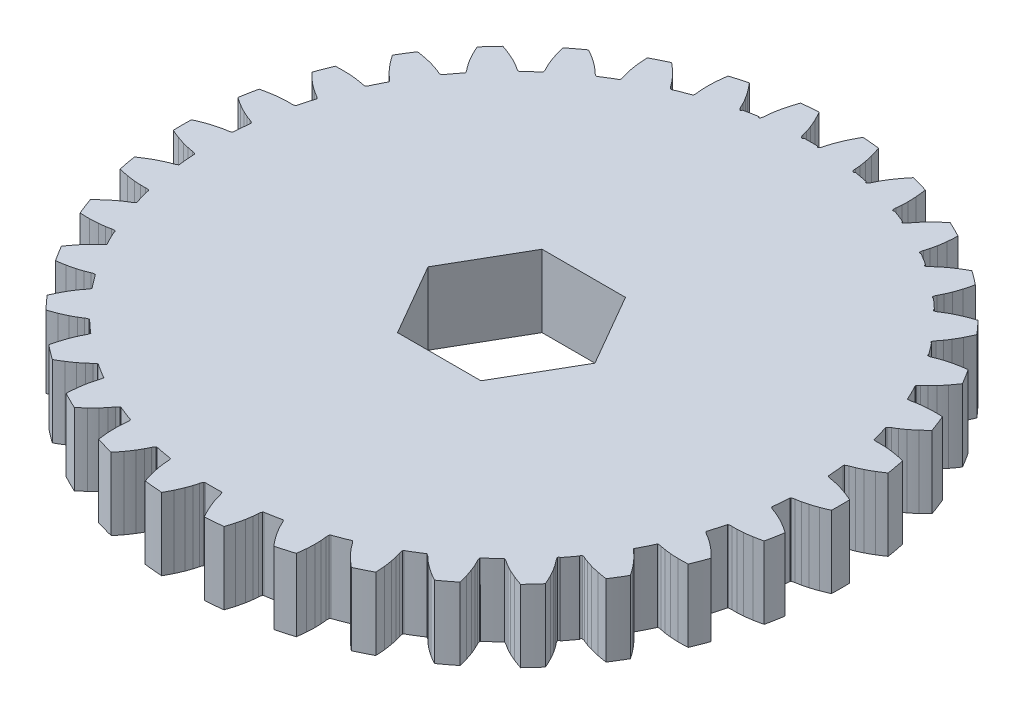
from build123d import *

# Parameters (mm, degrees)
BOSS_EXTRUDE1_DEPTH = 6.35


with BuildPart() as part:
    # Model → Boss-Extrude1 (new body)
    with BuildSketch(Plane(origin=(0, 0, 0), x_dir=(1, 0, 0), z_dir=(0, 1, 0))):
        with BuildLine():
            ThreePointArc((26.039547017, -3.158714239), (26.081656494, -2.789745335), (26.118538109, -2.420217249))
            ThreePointArc((26.118538109, -2.420217249), (26.15018278, -2.050225616), (26.176586464, -1.67982308))
            ThreePointArc((26.176586464, -1.67982308), (26.19430218, -1.656128647), (26.21828275, -1.638802221))
            ThreePointArc((26.21828275, -1.638802221), (26.349972724, -1.58470137), (26.488875474, -1.553473543))
            ThreePointArc((26.488875474, -1.553473543), (26.716015585, -1.517661861), (26.941580978, -1.472992407))
            ThreePointArc((26.941580978, -1.472992407), (27.208998909, -1.40997215), (27.474210372, -1.338231068))
            ThreePointArc((27.474210372, -1.338231068), (27.822373625, -1.230698091), (28.166198085, -1.110009516))
            ThreePointArc((28.166198085, -1.110009516), (28.547173014, -0.960699832), (28.922876054, -0.798581036))
            ThreePointArc((28.922876054, -0.798581036), (28.933898647, 0), (28.922876054, 0.798581036))
            ThreePointArc((28.922876054, 0.798581036), (28.547173011, 0.960699833), (28.166198079, 1.110009518))
            ThreePointArc((28.166198079, 1.110009518), (27.822373616, 1.230698094), (27.47421036, 1.338231071))
            ThreePointArc((27.47421036, 1.338231071), (27.208998897, 1.409972153), (26.941580965, 1.47299241))
            ThreePointArc((26.941580965, 1.47299241), (26.716015572, 1.517661864), (26.488875461, 1.553473545))
            ThreePointArc((26.488875461, 1.553473545), (26.349972724, 1.584701369), (26.218282762, 1.638802211))
            ThreePointArc((26.218282762, 1.638802211), (26.188796618, 1.65750247), (26.16748445, 1.685159727))
            ThreePointArc((26.16748445, 1.685159727), (26.111416775, 2.402273868), (26.035700465, 3.117580318))
            ThreePointArc((26.035700465, 3.117580318), (26.04260123, 3.167055317), (26.072995781, 3.206698314))
            ThreePointArc((26.072995781, 3.206698314), (26.192502478, 3.284075965), (26.323302047, 3.340295392))
            ThreePointArc((26.323302047, 3.340295392), (26.539994286, 3.417234198), (26.753511009, 3.502590602))
            ThreePointArc((26.753511009, 3.502590602), (27.0047957, 3.613675735), (27.252309044, 3.732927767))
            ThreePointArc((27.252309044, 3.732927767), (27.574785023, 3.902604621), (27.890578752, 4.084415822))
            ThreePointArc((27.890578752, 4.084415822), (28.237631276, 4.301187185), (28.577148007, 4.529580852))
            ThreePointArc((28.577148007, 4.529580852), (28.441244039, 5.316589925), (28.283670246, 6.099548205))
            ThreePointArc((28.283670246, 6.099548205), (27.884575011, 6.189871369), (27.482651318, 6.266634813))
            ThreePointArc((27.482651318, 6.266634813), (27.122504653, 6.322090857), (26.760510405, 6.36381805))
            ThreePointArc((26.760510405, 6.36381805), (26.486632282, 6.385605126), (26.212187706, 6.398414427))
            ThreePointArc((26.212187706, 6.398414427), (25.982255002, 6.400875766), (25.752402004, 6.394340799))
            ThreePointArc((25.752402004, 6.394340799), (25.610126253, 6.399513599), (25.470737559, 6.428495305))
            ThreePointArc((25.470737559, 6.428495305), (25.442493252, 6.434082805), (25.416780324, 6.447036816))
            ThreePointArc((25.416780324, 6.447036816), (25.227894102, 7.150549974), (25.019539308, 7.848544995))
            ThreePointArc((25.019539308, 7.848544995), (25.017231567, 7.8984456), (25.039824212, 7.942998585))
            ThreePointArc((25.039824212, 7.942998585), (25.143077974, 8.041018031), (25.261320139, 8.120314574))
            ThreePointArc((25.261320139, 8.120314574), (25.460185313, 8.235760445), (25.65438231, 8.358897088))
            ThreePointArc((25.65438231, 8.358897088), (25.880976562, 8.514264227), (26.102363017, 8.676966225))
            ThreePointArc((26.102363017, 8.676966225), (26.38817019, 8.903008813), (26.665179209, 9.139751279))
            ThreePointArc((26.665179209, 9.139751279), (26.966490872, 9.41660243), (27.258259459, 9.703493297))
            ThreePointArc((27.258259459, 9.703493297), (26.980056976, 10.452129756), (26.681297971, 11.192802576))
            ThreePointArc((26.681297971, 11.192802576), (26.272401252, 11.208254259), (25.863215829, 11.209857374))
            ThreePointArc((25.863215829, 11.209857374), (25.499011323, 11.198192398), (25.135513364, 11.172692838))
            ThreePointArc((25.135513364, 11.172692838), (24.862295171, 11.143783974), (24.590169834, 11.105946114))
            ThreePointArc((24.590169834, 11.105946114), (24.363699901, 11.06611552), (24.138961384, 11.017456446))
            ThreePointArc((24.138961384, 11.017456446), (23.998157648, 10.996398069), (23.855816937, 10.999273701))
            ThreePointArc((23.855816937, 10.999273701), (23.829640328, 10.995976243), (23.803412998, 10.998842458))
            ThreePointArc((23.803412998, 10.998842458), (23.486572972, 11.660098447), (23.151367748, 12.312236886))
            ThreePointArc((23.151367748, 12.312236886), (23.139930089, 12.360863792), (23.153951461, 12.408809565))
            ThreePointArc((23.153951461, 12.408809565), (23.237436106, 12.524132873), (23.339094271, 12.623806182))
            ThreePointArc((23.339094271, 12.623806182), (23.513360265, 12.773827747), (23.68162439, 12.93055136))
            ThreePointArc((23.68162439, 12.93055136), (23.875811807, 13.124909663), (24.063532324, 13.325521004))
            ThreePointArc((24.063532324, 13.325521004), (24.30293787, 13.600231718), (24.531728971, 13.883843467))
            ThreePointArc((24.531728971, 13.883843467), (24.793149492, 14.23368498), (25.041761869, 14.592741603))
            ThreePointArc((25.041761869, 14.592741603), (24.642190217, 15.257798213), (24.224960364, 15.911921328))
            ThreePointArc((24.224960364, 15.911921328), (23.79272998, 15.849417962), (23.363039544, 15.771341688))
            ThreePointArc((23.363039544, 15.771341688), (23.007179746, 15.692952927), (22.654556562, 15.601094971))
            ThreePointArc((22.654556562, 15.601094971), (22.391302418, 15.522474625), (22.13076322, 15.435278127))
            ThreePointArc((22.13076322, 15.435278127), (21.91546822, 15.354511984), (21.703497385, 15.265385829))
            ThreePointArc((21.703497385, 15.265385829), (21.568960567, 15.218813392), (21.428515081, 15.195485023))
            ThreePointArc((21.428515081, 15.195485023), (21.339460922, 15.238312212), (21.332995773, 15.336917553))
            ThreePointArc((21.332995773, 15.336917553), (20.967023721, 15.833561348), (20.58949199, 16.321475677))
            ThreePointArc((20.58949199, 16.321475677), (20.496420127, 16.354678643), (20.479598664, 16.452053418))
            ThreePointArc((20.479598664, 16.452053418), (20.540471221, 16.580753391), (20.622083541, 16.697409211))
            ThreePointArc((20.622083541, 16.697409211), (20.765815935, 16.876897667), (20.902417155, 17.061871214))
            ThreePointArc((20.902417155, 17.061871214), (21.057584918, 17.288602041), (21.205246899, 17.520291148))
            ThreePointArc((21.205246899, 17.520291148), (21.390098149, 17.834315043), (21.562880125, 18.155138018))
            ThreePointArc((21.562880125, 18.155138018), (21.758877489, 18.554118686), (21.940072505, 18.960036049))
            ThreePointArc((21.940072505, 18.960036049), (21.42934408, 19.535428351), (20.903530375, 20.097068602))
            ThreePointArc((20.903530375, 20.097068602), (20.482626013, 19.95409986), (20.067262968, 19.795751876))
            ThreePointArc((20.067262968, 19.795751876), (19.731866256, 19.653308767), (19.402126007, 19.498220527))
            ThreePointArc((19.402126007, 19.498220527), (19.157800716, 19.372566019), (18.917720007, 19.238980255))
            ThreePointArc((18.917720007, 19.238980255), (18.720931554, 19.120028957), (18.528946813, 18.993470805))
            ThreePointArc((18.528946813, 18.993470805), (18.405258403, 18.922970277), (18.271490845, 18.874232328))
            ThreePointArc((18.271490845, 18.874232328), (18.171589021, 18.904840123), (18.156103069, 19.008171613))
            ThreePointArc((18.156103069, 19.008171613), (17.70877484, 19.425600644), (17.251852246, 19.832505158))
            ThreePointArc((17.251852246, 19.832505158), (17.147532701, 19.838390811), (17.107837696, 19.935042324))
            ThreePointArc((17.107837696, 19.935042324), (17.144025225, 20.072736238), (17.202812489, 20.202401996))
            ThreePointArc((17.202812489, 20.202401996), (17.311116648, 20.405245077), (17.411403173, 20.612169507))
            ThreePointArc((17.411403173, 20.612169507), (17.52226723, 20.863551813), (17.624842223, 21.11842879))
            ThreePointArc((17.624842223, 21.11842879), (17.748844291, 21.46107216), (17.859733257, 21.808181118))
            ThreePointArc((17.859733257, 21.808181118), (17.980764446, 22.242890471), (18.085486232, 22.681814289))
            ThreePointArc((18.085486232, 22.681814289), (17.482113088, 23.150059043), (16.866622377, 23.602257546))
            ThreePointArc((16.866622377, 23.602257546), (16.473112668, 23.381416241), (16.08811982, 23.146041476))
            ThreePointArc((16.08811982, 23.146041476), (15.784607727, 22.944394748), (15.488979322, 22.731357568))
            ThreePointArc((15.488979322, 22.731357568), (15.271903088, 22.562947913), (15.060456529, 22.387521986))
            ThreePointArc((15.060456529, 22.387521986), (14.888876017, 22.234436276), (14.723415181, 22.074755914))
            ThreePointArc((14.723415181, 22.074755914), (14.614787239, 21.982728105), (14.492252902, 21.910240288))
            ThreePointArc((14.492252902, 21.910240288), (14.384331279, 21.925436409), (14.357220474, 22.030996833))
            ThreePointArc((14.357220474, 22.030996833), (13.843210143, 22.357552059), (13.321775772, 22.672117048))
            ThreePointArc((13.321775772, 22.672117048), (13.215197647, 22.649333307), (13.153489834, 22.739167273))
            ThreePointArc((13.153489834, 22.739167273), (13.163760011, 22.881166128), (13.19772029, 23.019426211))
            ThreePointArc((13.19772029, 23.019426211), (13.266908047, 23.238716341), (13.327464739, 23.460545089))
            ThreePointArc((13.327464739, 23.460545089), (13.390249747, 23.72801835), (13.444244684, 23.997403668))
            ThreePointArc((13.444244684, 23.997403668), (13.503174827, 24.356998204), (13.548394595, 24.718572767))
            ThreePointArc((13.548394595, 24.718572767), (13.587856271, 25.173548487), (13.610103634, 25.629690114))
            ThreePointArc((13.610103634, 25.629690114), (12.934985606, 25.976952933), (12.251014386, 26.306436148))
            ThreePointArc((12.251014386, 26.306436148), (11.900412538, 26.013795623), (11.561115047, 25.708120395))
            ThreePointArc((11.561115047, 25.708120395), (11.299823313, 25.454136884), (11.048374022, 25.190405491))
            ThreePointArc((11.048374022, 25.190405491), (10.865939117, 24.984975676), (10.690327267, 24.773683506))
            ThreePointArc((10.690327267, 24.773683506), (10.549797665, 24.591676535), (10.416495303, 24.404311685))
            ThreePointArc((10.416495303, 24.404311685), (10.326627024, 24.293890493), (10.219498669, 24.200121294))
            ThreePointArc((10.219498669, 24.200121294), (10.107150905, 24.197432846), (10.066174138, 24.302075822))
            ThreePointArc((10.066174138, 24.302075822), (9.502226677, 24.528074511), (8.933210143, 24.740988412))
            ThreePointArc((8.933210143, 24.740988412), (8.83243045, 24.691262183), (8.751215652, 24.768937153))
            ThreePointArc((8.751215652, 24.768937153), (8.735218739, 24.910405347), (8.743195555, 25.052551475))
            ThreePointArc((8.743195555, 25.052551475), (8.770910804, 25.28082099), (8.789675477, 25.509999946))
            ThreePointArc((8.789675477, 25.509999946), (8.802243369, 25.784455681), (8.805819518, 26.059175746))
            ThreePointArc((8.805819518, 26.059175746), (8.79767094, 26.423475887), (8.775681604, 26.787203066))
            ThreePointArc((8.775681604, 26.787203066), (8.730404112, 27.245633562), (8.667692096, 27.702005969))
            ThreePointArc((8.667692096, 27.702005969), (7.943442572, 27.918304767), (7.213806571, 28.115672066))
            ThreePointArc((7.213806571, 28.115672066), (6.920238625, 27.760670045), (6.640410367, 27.394740107))
            ThreePointArc((6.640410367, 27.394740107), (6.430236969, 27.097068918), (6.231529597, 26.791624367))
            ThreePointArc((6.231529597, 26.791624367), (6.089948622, 26.55617006), (5.956151732, 26.316206947))
            ThreePointArc((5.956151732, 26.316206947), (5.851458606, 26.111476744), (5.754854171, 25.902807892))
            ThreePointArc((5.754854171, 25.902807892), (5.686805911, 25.777753578), (5.598731665, 25.665896194))
            ThreePointArc((5.598731665, 25.665896194), (5.486245297, 25.643734929), (5.429734672, 25.743488896))
            ThreePointArc((5.429734672, 25.743488896), (4.834425845, 25.86189409), (4.236544006, 25.966534887))
            ThreePointArc((4.236544006, 25.966534887), (4.14781415, 25.893931074), (4.050929317, 25.955230586))
            ThreePointArc((4.050929317, 25.955230586), (4.009210069, 26.09135059), (3.990931782, 26.232542146))
            ThreePointArc((3.990931782, 26.232542146), (3.976230713, 26.462017603), (3.95256436, 26.69074235))
            ThreePointArc((3.95256436, 26.69074235), (3.91448715, 26.962834299), (3.867522728, 27.233533848))
            ThreePointArc((3.867522728, 27.233533848), (3.792572921, 27.59013379), (3.704123301, 27.943627293))
            ThreePointArc((3.704123301, 27.943627293), (3.57467779, 28.388184485), (3.428301751, 28.827458082))
            ThreePointArc((3.428301751, 28.827458082), (2.678605607, 28.906758109), (1.927103124, 28.966564621))
            ThreePointArc((1.927103124, 28.966564621), (1.702503102, 28.561667015), (1.493574476, 28.148464801))
            ThreePointArc((1.493574476, 28.148464801), (1.341676617, 27.817242769), (1.202477904, 27.480486608))
            ThreePointArc((1.202477904, 27.480486608), (1.10657223, 27.223025922), (1.019146593, 26.962563523))
            ThreePointArc((1.019146593, 26.962563523), (0.953855143, 26.74208193), (0.897238383, 26.519215043))
            ThreePointArc((0.897238383, 26.519215043), (0.853327443, 26.383786182), (0.787306569, 26.257649782))
            ThreePointArc((0.787306569, 26.257649782), (0.679502068, 26.215533389), (0.606763679, 26.305559649))
            ThreePointArc((0.606763679, 26.305559649), (-1.1e-08, 26.31255652), (-0.606763701, 26.305559649))
            ThreePointArc((-0.606763701, 26.305559649), (-0.679502069, 26.21553339), (-0.787306558, 26.25764977))
            ThreePointArc((-0.787306558, 26.25764977), (-0.853327442, 26.383786181), (-0.897238386, 26.519215057))
            ThreePointArc((-0.897238386, 26.519215057), (-0.953855146, 26.742081943), (-1.019146597, 26.962563536))
            ThreePointArc((-1.019146597, 26.962563536), (-1.106572234, 27.223025934), (-1.202477909, 27.480486619))
            ThreePointArc((-1.202477909, 27.480486619), (-1.341676621, 27.817242778), (-1.493574479, 28.148464807))
            ThreePointArc((-1.493574479, 28.148464807), (-1.702792839, 28.562213735), (-1.927724072, 28.967635045))
            ThreePointArc((-1.927724072, 28.967635045), (-2.67870796, 28.907862665), (-3.427888065, 28.828624379))
            ThreePointArc((-3.427888065, 28.828624379), (-3.574493448, 28.388775129), (-3.704123302, 27.943627286))
            ThreePointArc((-3.704123302, 27.943627286), (-3.792572923, 27.590133781), (-3.867522731, 27.233533837))
            ThreePointArc((-3.867522731, 27.233533837), (-3.914487151, 26.962834287), (-3.952564361, 26.690742337))
            ThreePointArc((-3.952564361, 26.690742337), (-3.976230714, 26.462017589), (-3.990931783, 26.232542133))
            ThreePointArc((-3.990931783, 26.232542133), (-4.009210067, 26.09135059), (-4.050929308, 25.955230599))
            ThreePointArc((-4.050929308, 25.955230599), (-4.14897935, 25.894009007), (-4.237117681, 25.968798903))
            ThreePointArc((-4.237117681, 25.968798903), (-4.834853424, 25.864181314), (-5.430017636, 25.745807254))
            ThreePointArc((-5.430017636, 25.745807254), (-5.485186935, 25.644228522), (-5.598731652, 25.665896185))
            ThreePointArc((-5.598731652, 25.665896185), (-5.686805909, 25.777753578), (-5.754854177, 25.902807905))
            ThreePointArc((-5.754854177, 25.902807905), (-5.851458612, 26.111476756), (-5.956151738, 26.316206959))
            ThreePointArc((-5.956151738, 26.316206959), (-6.089948628, 26.55617007), (-6.231529603, 26.791624377))
            ThreePointArc((-6.231529603, 26.791624377), (-6.430236974, 27.097068926), (-6.64041037, 27.394740112))
            ThreePointArc((-6.64041037, 27.394740112), (-6.921344677, 27.762060476), (-7.21612322, 28.118366447))
            ThreePointArc((-7.21612322, 28.118366447), (-7.944314362, 27.921368793), (-8.66714085, 27.705516336))
            ThreePointArc((-8.66714085, 27.705516336), (-8.730195696, 27.247397985), (-8.775681604, 26.787203059))
            ThreePointArc((-8.775681604, 26.787203059), (-8.79767094, 26.423475878), (-8.805819518, 26.059175734))
            ThreePointArc((-8.805819518, 26.059175734), (-8.802243368, 25.784455669), (-8.789675476, 25.509999932))
            ThreePointArc((-8.789675476, 25.509999932), (-8.770910802, 25.280820977), (-8.743195553, 25.052551462))
            ThreePointArc((-8.743195553, 25.052551462), (-8.735218737, 24.910405348), (-8.751215646, 24.768937167))
            ThreePointArc((-8.751215646, 24.768937167), (-8.743605771, 24.746062493), (-8.740091863, 24.722212684))
            ThreePointArc((-8.740091863, 24.722212684), (-9.435606495, 24.465206637), (-10.123576332, 24.188637994))
            ThreePointArc((-10.123576332, 24.188637994), (-10.173051139, 24.18173585), (-10.219498654, 24.200121288))
            ThreePointArc((-10.219498654, 24.200121288), (-10.326627022, 24.293890494), (-10.416495311, 24.404311697))
            ThreePointArc((-10.416495311, 24.404311697), (-10.549797673, 24.591676546), (-10.690327276, 24.773683516))
            ThreePointArc((-10.690327276, 24.773683516), (-10.865939125, 24.984975686), (-11.04837403, 25.190405499))
            ThreePointArc((-11.04837403, 25.190405499), (-11.299823319, 25.454136891), (-11.561115051, 25.7081204))
            ThreePointArc((-11.561115051, 25.7081204), (-11.864586738, 25.982602118), (-12.177174788, 26.246655122))
            ThreePointArc((-12.177174788, 26.246655122), (-12.896948409, 25.900563944), (-13.606895645, 25.534738726))
            ThreePointArc((-13.606895645, 25.534738726), (-13.584553185, 25.126160587), (-13.548394594, 24.71857276))
            ThreePointArc((-13.548394594, 24.71857276), (-13.503174826, 24.356998195), (-13.444244682, 23.997403656))
            ThreePointArc((-13.444244682, 23.997403656), (-13.390249744, 23.728018338), (-13.327464735, 23.460545076))
            ThreePointArc((-13.327464735, 23.460545076), (-13.266908043, 23.238716328), (-13.197720285, 23.019426198))
            ThreePointArc((-13.197720285, 23.019426198), (-13.16376001, 22.881166128), (-13.153489831, 22.739167288))
            ThreePointArc((-13.153489831, 22.739167288), (-13.142387478, 22.717653893), (-13.135326412, 22.694497258))
            ThreePointArc((-13.135326412, 22.694497258), (-13.771084204, 22.314440293), (-14.395853775, 21.916578196))
            ThreePointArc((-14.395853775, 21.916578196), (-14.443217913, 21.900702603), (-14.492252887, 21.910240285))
            ThreePointArc((-14.492252887, 21.910240285), (-14.614787238, 21.982728106), (-14.72341519, 22.074755923))
            ThreePointArc((-14.72341519, 22.074755923), (-14.888876027, 22.234436285), (-15.060456539, 22.387521994))
            ThreePointArc((-15.060456539, 22.387521994), (-15.271903098, 22.562947921), (-15.488979331, 22.731357575))
            ThreePointArc((-15.488979331, 22.731357575), (-15.784607734, 22.944394753), (-16.088119825, 23.14604148))
            ThreePointArc((-16.088119825, 23.14604148), (-16.436860213, 23.360086849), (-16.792645469, 23.562205946))
            ThreePointArc((-16.792645469, 23.562205946), (-17.43656949, 23.089749572), (-18.067208318, 22.599700761))
            ThreePointArc((-18.067208318, 22.599700761), (-17.970170244, 22.202184858), (-17.859733256, 21.808181112))
            ThreePointArc((-17.859733256, 21.808181112), (-17.748844288, 21.461072151), (-17.624842219, 21.118428779))
            ThreePointArc((-17.624842219, 21.118428779), (-17.522267225, 20.863551801), (-17.411403167, 20.612169495))
            ThreePointArc((-17.411403167, 20.612169495), (-17.311116642, 20.405245065), (-17.202812482, 20.202401984))
            ThreePointArc((-17.202812482, 20.202401984), (-17.144025224, 20.072736239), (-17.107837695, 19.935042339))
            ThreePointArc((-17.107837695, 19.935042339), (-17.093770168, 19.915068932), (-17.083717189, 19.892803039))
            ThreePointArc((-17.083717189, 19.892803039), (-17.637819927, 19.403203703), (-18.177897684, 18.898175614))
            ThreePointArc((-18.177897684, 18.898175614), (-18.221538225, 18.873867195), (-18.271490829, 18.874232327))
            ThreePointArc((-18.271490829, 18.874232327), (-18.405258402, 18.922970278), (-18.528946824, 18.993470813))
            ThreePointArc((-18.528946824, 18.993470813), (-18.720931566, 19.120028964), (-18.917720019, 19.238980262))
            ThreePointArc((-18.917720019, 19.238980262), (-19.157800727, 19.372566025), (-19.402126018, 19.498220532))
            ThreePointArc((-19.402126018, 19.498220532), (-19.731866264, 19.653308771), (-20.067262974, 19.795751879))
            ThreePointArc((-20.067262974, 19.795751879), (-20.449396127, 19.942071841), (-20.83626275, 20.075374106))
            ThreePointArc((-20.83626275, 20.075374106), (-21.38240911, 19.492641472), (-21.912263881, 18.895057092))
            ThreePointArc((-21.912263881, 18.895057092), (-21.743834709, 18.522140352), (-21.562880121, 18.155138012))
            ThreePointArc((-21.562880121, 18.155138012), (-21.390098145, 17.834315035), (-21.205246893, 17.520291138))
            ThreePointArc((-21.205246893, 17.520291138), (-21.057584911, 17.288602031), (-20.902417147, 17.061871203))
            ThreePointArc((-20.902417147, 17.061871203), (-20.765815926, 16.876897656), (-20.622083532, 16.697409201))
            ThreePointArc((-20.622083532, 16.697409201), (-20.54047122, 16.580753392), (-20.479598666, 16.452053433))
            ThreePointArc((-20.479598666, 16.452053433), (-20.463039822, 16.4334639), (-20.45057791, 16.411912408))
            ThreePointArc((-20.45057791, 16.411912408), (-20.904013632, 15.830325955), (-21.340915089, 15.236218327))
            ThreePointArc((-21.340915089, 15.236218327), (-21.379345906, 15.204304877), (-21.428515066, 15.195485025))
            ThreePointArc((-21.428515066, 15.195485025), (-21.568960566, 15.218813393), (-21.703497397, 15.265385834))
            ThreePointArc((-21.703497397, 15.265385834), (-21.915468233, 15.354511989), (-22.130763232, 15.435278131))
            ThreePointArc((-22.130763232, 15.435278131), (-22.39130243, 15.522474628), (-22.654556573, 15.601094975))
            ThreePointArc((-22.654556573, 15.601094975), (-23.007179754, 15.692952929), (-23.36303955, 15.771341689))
            ThreePointArc((-23.36303955, 15.771341689), (-23.765552383, 15.844953493), (-24.170326093, 15.904899479))
            ThreePointArc((-24.170326093, 15.904899479), (-24.600096433, 15.231734845), (-25.011123578, 14.546964916))
            ThreePointArc((-25.011123578, 14.546964916), (-24.777038962, 14.211346572), (-24.531728967, 13.883843462))
            ThreePointArc((-24.531728967, 13.883843462), (-24.302937864, 13.600231711), (-24.063532316, 13.325520995))
            ThreePointArc((-24.063532316, 13.325520995), (-23.875811799, 13.124909653), (-23.68162438, 12.930551351))
            ThreePointArc((-23.68162438, 12.930551351), (-23.513360255, 12.773827738), (-23.339094261, 12.623806174))
            ThreePointArc((-23.339094261, 12.623806174), (-23.237436105, 12.524132874), (-23.153951466, 12.408809579))
            ThreePointArc((-23.153951466, 12.408809579), (-23.135182164, 12.390988008), (-23.120861787, 12.369428279))
            ThreePointArc((-23.120861787, 12.369428279), (-23.458229944, 11.717015561), (-23.777193226, 11.055409899))
            ThreePointArc((-23.777193226, 11.055409899), (-23.809105605, 11.016978192), (-23.855816922, 10.999273706))
            ThreePointArc((-23.855816922, 10.999273706), (-23.998157647, 10.99639807), (-24.138961397, 11.017456449))
            ThreePointArc((-24.138961397, 11.017456449), (-24.363699914, 11.066115523), (-24.590169847, 11.105946116))
            ThreePointArc((-24.590169847, 11.105946116), (-24.862295184, 11.143783976), (-25.135513376, 11.172692839))
            ThreePointArc((-25.135513376, 11.172692839), (-25.499011332, 11.198192398), (-25.863215835, 11.209857374))
            ThreePointArc((-25.863215835, 11.209857374), (-26.272401256, 11.208254259), (-26.681297971, 11.192802576))
            ThreePointArc((-26.681297971, 11.192802576), (-26.980056976, 10.452129756), (-27.258259459, 9.703493297))
            ThreePointArc((-27.258259459, 9.703493297), (-26.966490869, 9.416602428), (-26.665179204, 9.139751274))
            ThreePointArc((-26.665179204, 9.139751274), (-26.388170183, 8.903008807), (-26.102363008, 8.676966218))
            ThreePointArc((-26.102363008, 8.676966218), (-25.880976551, 8.51426422), (-25.654382299, 8.358897081))
            ThreePointArc((-25.654382299, 8.358897081), (-25.460185302, 8.235760438), (-25.261320127, 8.120314568))
            ThreePointArc((-25.261320127, 8.120314568), (-25.143077974, 8.041018033), (-25.03982422, 7.942998598))
            ThreePointArc((-25.03982422, 7.942998598), (-25.018642166, 7.924542889), (-25.002947755, 7.901240999))
            ThreePointArc((-25.002947755, 7.901240999), (-25.213120048, 7.202470632), (-25.403767565, 6.498122747))
            ThreePointArc((-25.403767565, 6.498122747), (-25.428074768, 6.454481528), (-25.470737545, 6.428495312))
            ThreePointArc((-25.470737545, 6.428495312), (-25.610126252, 6.3995136), (-25.752402018, 6.394340799))
            ThreePointArc((-25.752402018, 6.394340799), (-25.982255016, 6.400875766), (-26.21218772, 6.398414426))
            ThreePointArc((-26.21218772, 6.398414426), (-26.486632294, 6.385605125), (-26.760510417, 6.363818049))
            ThreePointArc((-26.760510417, 6.363818049), (-27.122504662, 6.322090855), (-27.482651325, 6.266634811))
            ThreePointArc((-27.482651325, 6.266634811), (-27.884575014, 6.189871368), (-28.283670246, 6.099548205))
            ThreePointArc((-28.283670246, 6.099548205), (-28.441244039, 5.316589925), (-28.577148007, 4.529580852))
            ThreePointArc((-28.577148007, 4.529580852), (-28.237631273, 4.301187183), (-27.890578746, 4.084415819))
            ThreePointArc((-27.890578746, 4.084415819), (-27.574785015, 3.902604616), (-27.252309033, 3.732927762))
            ThreePointArc((-27.252309033, 3.732927762), (-27.004795688, 3.61367573), (-26.753510997, 3.502590596))
            ThreePointArc((-26.753510997, 3.502590596), (-26.539994274, 3.417234193), (-26.323302034, 3.340295388))
            ThreePointArc((-26.323302034, 3.340295388), (-26.192502478, 3.284075966), (-26.072995791, 3.206698326))
            ThreePointArc((-26.072995791, 3.206698326), (-26.04762693, 3.183829267), (-26.031336753, 3.153809223))
            ThreePointArc((-26.031336753, 3.153809223), (-26.108142708, 2.437599245), (-26.165247069, 1.719549818))
            ThreePointArc((-26.165247069, 1.719549818), (-26.181121342, 1.672185237), (-26.21828275, 1.638802221))
            ThreePointArc((-26.21828275, 1.638802221), (-26.349972724, 1.58470137), (-26.488875474, 1.553473543))
            ThreePointArc((-26.488875474, 1.553473543), (-26.716015585, 1.517661861), (-26.941580978, 1.472992407))
            ThreePointArc((-26.941580978, 1.472992407), (-27.208998909, 1.40997215), (-27.474210372, 1.338231068))
            ThreePointArc((-27.474210372, 1.338231068), (-27.822373625, 1.230698091), (-28.166198085, 1.110009516))
            ThreePointArc((-28.166198085, 1.110009516), (-28.547173014, 0.960699832), (-28.922876054, 0.798581036))
            ThreePointArc((-28.922876054, 0.798581036), (-28.933898647, 0), (-28.922876054, -0.798581036))
            ThreePointArc((-28.922876054, -0.798581036), (-28.547173011, -0.960699833), (-28.166198079, -1.110009518))
            ThreePointArc((-28.166198079, -1.110009518), (-27.822373616, -1.230698094), (-27.47421036, -1.338231071))
            ThreePointArc((-27.47421036, -1.338231071), (-27.208998897, -1.409972153), (-26.941580965, -1.47299241))
            ThreePointArc((-26.941580965, -1.47299241), (-26.716015572, -1.517661864), (-26.488875461, -1.553473545))
            ThreePointArc((-26.488875461, -1.553473545), (-26.349972724, -1.584701369), (-26.218282762, -1.638802211))
            ThreePointArc((-26.218282762, -1.638802211), (-26.171313035, -1.691469631), (-26.17191353, -1.762036278))
            ThreePointArc((-26.17191353, -1.762036278), (-26.115359118, -2.46208201), (-26.040083277, -3.160362739))
            ThreePointArc((-26.040083277, -3.160362739), (-26.053106056, -3.185969348), (-26.072995781, -3.206698314))
            ThreePointArc((-26.072995781, -3.206698314), (-26.192502478, -3.284075965), (-26.323302047, -3.340295392))
            ThreePointArc((-26.323302047, -3.340295392), (-26.539994286, -3.417234198), (-26.753511009, -3.502590602))
            ThreePointArc((-26.753511009, -3.502590602), (-27.0047957, -3.613675735), (-27.252309044, -3.732927767))
            ThreePointArc((-27.252309044, -3.732927767), (-27.574785023, -3.902604621), (-27.890578752, -4.084415822))
            ThreePointArc((-27.890578752, -4.084415822), (-28.246780691, -4.307125444), (-28.595028735, -4.542077985))
            ThreePointArc((-28.595028735, -4.542077985), (-28.460528252, -5.320194769), (-28.304858014, -6.09435424))
            ThreePointArc((-28.304858014, -6.09435424), (-27.895251733, -6.187639257), (-27.482651318, -6.266634813))
            ThreePointArc((-27.482651318, -6.266634813), (-27.122504653, -6.322090857), (-26.760510405, -6.36381805))
            ThreePointArc((-26.760510405, -6.36381805), (-26.486632282, -6.385605126), (-26.212187706, -6.398414427))
            ThreePointArc((-26.212187706, -6.398414427), (-25.982255002, -6.400875766), (-25.752402004, -6.394340799))
            ThreePointArc((-25.752402004, -6.394340799), (-25.610126253, -6.399513599), (-25.470737559, -6.428495305))
            ThreePointArc((-25.470737559, -6.428495305), (-25.407829004, -6.485741359), (-25.413393337, -6.570615591))
            ThreePointArc((-25.413393337, -6.570615591), (-25.228374999, -7.248630563), (-25.025271088, -7.921449178))
            ThreePointArc((-25.025271088, -7.921449178), (-25.031829598, -7.932708809), (-25.039824212, -7.942998585))
            ThreePointArc((-25.039824212, -7.942998585), (-25.143077974, -8.041018031), (-25.261320139, -8.120314574))
            ThreePointArc((-25.261320139, -8.120314574), (-25.460185313, -8.235760445), (-25.65438231, -8.358897088))
            ThreePointArc((-25.65438231, -8.358897088), (-25.880976562, -8.514264227), (-26.102363017, -8.676966225))
            ThreePointArc((-26.102363017, -8.676966225), (-26.38817019, -8.903008813), (-26.665179209, -9.139751279))
            ThreePointArc((-26.665179209, -9.139751279), (-26.981883595, -9.431259495), (-27.28800839, -9.733858764))
            ThreePointArc((-27.28800839, -9.733858764), (-27.015692033, -10.465934851), (-26.723739779, -11.19040395))
            ThreePointArc((-26.723739779, -11.19040395), (-26.293651012, -11.207792568), (-25.863215829, -11.209857374))
            ThreePointArc((-25.863215829, -11.209857374), (-25.499011323, -11.198192398), (-25.135513364, -11.172692838))
            ThreePointArc((-25.135513364, -11.172692838), (-24.862295171, -11.143783974), (-24.590169834, -11.105946114))
            ThreePointArc((-24.590169834, -11.105946114), (-24.363699901, -11.06611552), (-24.138961384, -11.017456446))
            ThreePointArc((-24.138961384, -11.017456446), (-23.998157648, -10.996398069), (-23.855816937, -10.999273701))
            ThreePointArc((-23.855816937, -10.999273701), (-23.778189878, -11.053330716), (-23.782445156, -11.147829466))
            ThreePointArc((-23.782445156, -11.147829466), (-23.475469745, -11.780539871), (-23.151665373, -12.404805111))
            ThreePointArc((-23.151665373, -12.404805111), (-23.152784857, -12.406820788), (-23.153951461, -12.408809565))
            ThreePointArc((-23.153951461, -12.408809565), (-23.237436106, -12.524132873), (-23.339094271, -12.623806182))
            ThreePointArc((-23.339094271, -12.623806182), (-23.513360265, -12.773827747), (-23.68162439, -12.93055136))
            ThreePointArc((-23.68162439, -12.93055136), (-23.875811807, -13.124909663), (-24.063532324, -13.325521004))
            ThreePointArc((-24.063532324, -13.325521004), (-24.30293787, -13.600231718), (-24.531728971, -13.883843467))
            ThreePointArc((-24.531728971, -13.883843467), (-24.777038964, -14.211346574), (-25.011123578, -14.546964916))
            ThreePointArc((-25.011123578, -14.546964916), (-24.600096433, -15.231734845), (-24.170326093, -15.904899479))
            ThreePointArc((-24.170326093, -15.904899479), (-23.765552379, -15.844953493), (-23.363039544, -15.771341688))
            ThreePointArc((-23.363039544, -15.771341688), (-23.007179746, -15.692952927), (-22.654556562, -15.601094971))
            ThreePointArc((-22.654556562, -15.601094971), (-22.391302418, -15.522474625), (-22.13076322, -15.435278127))
            ThreePointArc((-22.13076322, -15.435278127), (-21.91546822, -15.354511984), (-21.703497385, -15.265385829))
            ThreePointArc((-21.703497385, -15.265385829), (-21.568960567, -15.218813392), (-21.428515081, -15.195485023))
            ThreePointArc((-21.428515081, -15.195485023), (-21.379345923, -15.20430487), (-21.3409151, -15.236218311))
            ThreePointArc((-21.3409151, -15.236218311), (-20.904013639, -15.830325945), (-20.450577914, -16.411912404))
            ThreePointArc((-20.450577914, -16.411912404), (-20.463039823, -16.43346389), (-20.479598664, -16.452053418))
            ThreePointArc((-20.479598664, -16.452053418), (-20.540471221, -16.580753391), (-20.622083541, -16.697409211))
            ThreePointArc((-20.622083541, -16.697409211), (-20.765815935, -16.876897667), (-20.902417155, -17.061871214))
            ThreePointArc((-20.902417155, -17.061871214), (-21.057584918, -17.288602041), (-21.205246899, -17.520291148))
            ThreePointArc((-21.205246899, -17.520291148), (-21.390098149, -17.834315043), (-21.562880125, -18.155138018))
            ThreePointArc((-21.562880125, -18.155138018), (-21.743834711, -18.522140355), (-21.912263881, -18.895057092))
            ThreePointArc((-21.912263881, -18.895057092), (-21.38240911, -19.492641472), (-20.83626275, -20.075374106))
            ThreePointArc((-20.83626275, -20.075374106), (-20.449396124, -19.94207184), (-20.067262968, -19.795751876))
            ThreePointArc((-20.067262968, -19.795751876), (-19.731866256, -19.653308767), (-19.402126007, -19.498220527))
            ThreePointArc((-19.402126007, -19.498220527), (-19.157800716, -19.372566019), (-18.917720007, -19.238980255))
            ThreePointArc((-18.917720007, -19.238980255), (-18.720931554, -19.120028957), (-18.528946813, -18.993470805))
            ThreePointArc((-18.528946813, -18.993470805), (-18.405258403, -18.922970277), (-18.271490845, -18.874232328))
            ThreePointArc((-18.271490845, -18.874232328), (-18.221538242, -18.873867192), (-18.177897698, -18.8981756))
            ThreePointArc((-18.177897698, -18.8981756), (-17.637819937, -19.403203695), (-17.083717193, -19.892803035))
            ThreePointArc((-17.083717193, -19.892803035), (-17.093770171, -19.915068922), (-17.107837696, -19.935042324))
            ThreePointArc((-17.107837696, -19.935042324), (-17.144025225, -20.072736238), (-17.202812489, -20.202401996))
            ThreePointArc((-17.202812489, -20.202401996), (-17.311116648, -20.405245077), (-17.411403173, -20.612169507))
            ThreePointArc((-17.411403173, -20.612169507), (-17.52226723, -20.863551813), (-17.624842223, -21.11842879))
            ThreePointArc((-17.624842223, -21.11842879), (-17.748844291, -21.46107216), (-17.859733257, -21.808181118))
            ThreePointArc((-17.859733257, -21.808181118), (-17.970170245, -22.202184861), (-18.067208318, -22.599700761))
            ThreePointArc((-18.067208318, -22.599700761), (-17.43656949, -23.089749572), (-16.792645469, -23.562205946))
            ThreePointArc((-16.792645469, -23.562205946), (-16.43686021, -23.360086848), (-16.08811982, -23.146041476))
            ThreePointArc((-16.08811982, -23.146041476), (-15.784607727, -22.944394748), (-15.488979322, -22.731357568))
            ThreePointArc((-15.488979322, -22.731357568), (-15.271903088, -22.562947913), (-15.060456529, -22.387521986))
            ThreePointArc((-15.060456529, -22.387521986), (-14.888876017, -22.234436276), (-14.723415181, -22.074755914))
            ThreePointArc((-14.723415181, -22.074755914), (-14.614787239, -21.982728105), (-14.492252902, -21.910240288))
            ThreePointArc((-14.492252902, -21.910240288), (-14.443217931, -21.900702602), (-14.395853792, -21.916578185))
            ThreePointArc((-14.395853792, -21.916578185), (-13.771084215, -22.314440286), (-13.135326417, -22.694497255))
            ThreePointArc((-13.135326417, -22.694497255), (-13.142387483, -22.717653884), (-13.153489834, -22.739167273))
            ThreePointArc((-13.153489834, -22.739167273), (-13.163760011, -22.881166128), (-13.19772029, -23.019426211))
            ThreePointArc((-13.19772029, -23.019426211), (-13.266908047, -23.238716341), (-13.327464739, -23.460545089))
            ThreePointArc((-13.327464739, -23.460545089), (-13.390249747, -23.72801835), (-13.444244684, -23.997403668))
            ThreePointArc((-13.444244684, -23.997403668), (-13.503174827, -24.356998204), (-13.548394595, -24.718572767))
            ThreePointArc((-13.548394595, -24.718572767), (-13.584553185, -25.126160591), (-13.606895645, -25.534738726))
            ThreePointArc((-13.606895645, -25.534738726), (-12.896948409, -25.900563944), (-12.177174788, -26.246655122))
            ThreePointArc((-12.177174788, -26.246655122), (-11.864586735, -25.982602116), (-11.561115047, -25.708120395))
            ThreePointArc((-11.561115047, -25.708120395), (-11.299823313, -25.454136884), (-11.048374022, -25.190405491))
            ThreePointArc((-11.048374022, -25.190405491), (-10.865939117, -24.984975676), (-10.690327267, -24.773683506))
            ThreePointArc((-10.690327267, -24.773683506), (-10.549797665, -24.591676535), (-10.416495303, -24.404311685))
            ThreePointArc((-10.416495303, -24.404311685), (-10.326627024, -24.293890493), (-10.219498669, -24.200121294))
            ThreePointArc((-10.219498669, -24.200121294), (-10.173051156, -24.181735853), (-10.123576351, -24.188637986))
            ThreePointArc((-10.123576351, -24.188637986), (-9.435606507, -24.465206633), (-8.740091869, -24.722212682))
            ThreePointArc((-8.740091869, -24.722212682), (-8.743605778, -24.746062484), (-8.751215652, -24.768937153))
            ThreePointArc((-8.751215652, -24.768937153), (-8.735218739, -24.910405347), (-8.743195555, -25.052551475))
            ThreePointArc((-8.743195555, -25.052551475), (-8.770910804, -25.28082099), (-8.789675477, -25.509999946))
            ThreePointArc((-8.789675477, -25.509999946), (-8.802243369, -25.784455681), (-8.805819518, -26.059175746))
            ThreePointArc((-8.805819518, -26.059175746), (-8.79767094, -26.423475887), (-8.775681604, -26.787203066))
            ThreePointArc((-8.775681604, -26.787203066), (-8.736330459, -27.194495056), (-8.683216461, -27.600221789))
            ThreePointArc((-8.683216461, -27.600221789), (-7.918137218, -27.829365675), (-7.147025024, -28.037305937))
            ThreePointArc((-7.147025024, -28.037305937), (-6.888278989, -27.720311031), (-6.640410367, -27.394740107))
            ThreePointArc((-6.640410367, -27.394740107), (-6.430236969, -27.097068918), (-6.231529597, -26.791624367))
            ThreePointArc((-6.231529597, -26.791624367), (-6.089948622, -26.55617006), (-5.956151732, -26.316206947))
            ThreePointArc((-5.956151732, -26.316206947), (-5.851458606, -26.111476744), (-5.754854171, -25.902807892))
            ThreePointArc((-5.754854171, -25.902807892), (-5.686805911, -25.777753578), (-5.598731665, -25.665896194))
            ThreePointArc((-5.598731665, -25.665896194), (-5.556453326, -25.639289092), (-5.506552659, -25.636982731))
            ThreePointArc((-5.506552659, -25.636982731), (-4.779095632, -25.782498922), (-4.047813195, -25.9073776))
            ThreePointArc((-4.047813195, -25.9073776), (-4.047307159, -25.931438504), (-4.050929317, -25.955230586))
            ThreePointArc((-4.050929317, -25.955230586), (-4.009210069, -26.09135059), (-3.990931782, -26.232542146))
            ThreePointArc((-3.990931782, -26.232542146), (-3.976230713, -26.462017603), (-3.95256436, -26.69074235))
            ThreePointArc((-3.95256436, -26.69074235), (-3.91448715, -26.962834299), (-3.867522728, -27.233533848))
            ThreePointArc((-3.867522728, -27.233533848), (-3.792572921, -27.59013379), (-3.704123301, -27.943627293))
            ThreePointArc((-3.704123301, -27.943627293), (-3.590602477, -28.336753609), (-3.463840755, -28.725812401))
            ThreePointArc((-3.463840755, -28.725812401), (-2.669683361, -28.810471736), (-1.873491894, -28.873179926))
            ThreePointArc((-1.873491894, -28.873179926), (-1.677399164, -28.514038001), (-1.493574476, -28.148464801))
            ThreePointArc((-1.493574476, -28.148464801), (-1.341676617, -27.817242769), (-1.202477904, -27.480486608))
            ThreePointArc((-1.202477904, -27.480486608), (-1.10657223, -27.223025922), (-1.019146593, -26.962563523))
            ThreePointArc((-1.019146593, -26.962563523), (-0.953855143, -26.74208193), (-0.897238383, -26.519215043))
            ThreePointArc((-0.897238383, -26.519215043), (-0.853327443, -26.383786182), (-0.787306569, -26.257649782))
            ThreePointArc((-0.787306569, -26.257649782), (-0.750637141, -26.223727091), (-0.702009921, -26.212290778))
            ThreePointArc((-0.702009921, -26.212290778), (0.039844092, -26.221659333), (0.781666207, -26.210036316))
            ThreePointArc((0.781666207, -26.210036316), (0.786536431, -26.233600192), (0.787306558, -26.25764977))
            ThreePointArc((0.787306558, -26.25764977), (0.853327442, -26.383786181), (0.897238386, -26.519215057))
            ThreePointArc((0.897238386, -26.519215057), (0.953855146, -26.742081943), (1.019146597, -26.962563536))
            ThreePointArc((1.019146597, -26.962563536), (1.106572234, -27.223025934), (1.202477909, -27.480486619))
            ThreePointArc((1.202477909, -27.480486619), (1.341676621, -27.817242778), (1.493574479, -28.148464807))
            ThreePointArc((1.493574479, -28.148464807), (1.677399165, -28.514038004), (1.873491894, -28.873179926))
            ThreePointArc((1.873491894, -28.873179926), (2.669683361, -28.810471736), (3.463840755, -28.725812401))
            ThreePointArc((3.463840755, -28.725812401), (3.590602478, -28.336753606), (3.704123302, -27.943627286))
            ThreePointArc((3.704123302, -27.943627286), (3.792572923, -27.590133781), (3.867522731, -27.233533837))
            ThreePointArc((3.867522731, -27.233533837), (3.914487151, -26.962834287), (3.952564361, -26.690742337))
            ThreePointArc((3.952564361, -26.690742337), (3.976230714, -26.462017589), (3.990931783, -26.232542133))
            ThreePointArc((3.990931783, -26.232542133), (4.009210067, -26.09135059), (4.050929308, -25.955230599))
            ThreePointArc((4.050929308, -25.955230599), (4.080741091, -25.915147517), (4.126438924, -25.8949707))
            ThreePointArc((4.126438924, -25.8949707), (4.857105698, -25.767916679), (5.583887106, -25.620250009))
            ThreePointArc((5.583887106, -25.620250009), (5.593298057, -25.642426361), (5.598731652, -25.665896185))
            ThreePointArc((5.598731652, -25.665896185), (5.686805909, -25.777753578), (5.754854177, -25.902807905))
            ThreePointArc((5.754854177, -25.902807905), (5.851458612, -26.111476756), (5.956151738, -26.316206959))
            ThreePointArc((5.956151738, -26.316206959), (6.089948628, -26.55617007), (6.231529603, -26.791624377))
            ThreePointArc((6.231529603, -26.791624377), (6.430236974, -27.097068926), (6.64041037, -27.394740112))
            ThreePointArc((6.64041037, -27.394740112), (6.888278991, -27.720311034), (7.147025024, -28.037305937))
            ThreePointArc((7.147025024, -28.037305937), (7.918137218, -27.829365675), (8.683216461, -27.600221789))
            ThreePointArc((8.683216461, -27.600221789), (8.736330459, -27.194495053), (8.775681604, -26.787203059))
            ThreePointArc((8.775681604, -26.787203059), (8.79767094, -26.423475878), (8.805819518, -26.059175734))
            ThreePointArc((8.805819518, -26.059175734), (8.802243368, -25.784455669), (8.789675476, -25.509999932))
            ThreePointArc((8.789675476, -25.509999932), (8.770910802, -25.280820977), (8.743195553, -25.052551462))
            ThreePointArc((8.743195553, -25.052551462), (8.735218737, -24.910405348), (8.751215646, -24.768937167))
            ThreePointArc((8.751215646, -24.768937167), (8.77315458, -24.724058676), (8.814366839, -24.695828453))
            ThreePointArc((8.814366839, -24.695828453), (9.508665685, -24.436904113), (10.195370997, -24.158464686))
            ThreePointArc((10.195370997, -24.158464686), (10.209296404, -24.178214754), (10.219498654, -24.200121288))
            ThreePointArc((10.219498654, -24.200121288), (10.326627022, -24.293890494), (10.416495311, -24.404311697))
            ThreePointArc((10.416495311, -24.404311697), (10.549797673, -24.591676546), (10.690327276, -24.773683516))
            ThreePointArc((10.690327276, -24.773683516), (10.865939125, -24.984975686), (11.04837403, -25.190405499))
            ThreePointArc((11.04837403, -25.190405499), (11.299823319, -25.454136891), (11.561115051, -25.7081204))
            ThreePointArc((11.561115051, -25.7081204), (11.864586738, -25.982602118), (12.177174788, -26.246655122))
            ThreePointArc((12.177174788, -26.246655122), (12.896948409, -25.900563944), (13.606895645, -25.534738726))
            ThreePointArc((13.606895645, -25.534738726), (13.584553185, -25.126160587), (13.548394594, -24.71857276))
            ThreePointArc((13.548394594, -24.71857276), (13.503174826, -24.356998195), (13.444244682, -23.997403656))
            ThreePointArc((13.444244682, -23.997403656), (13.390249744, -23.728018338), (13.327464735, -23.460545076))
            ThreePointArc((13.327464735, -23.460545076), (13.266908043, -23.238716328), (13.197720285, -23.019426198))
            ThreePointArc((13.197720285, -23.019426198), (13.16376001, -22.881166128), (13.153489831, -22.739167288))
            ThreePointArc((13.153489831, -22.739167288), (13.166808812, -22.69102167), (13.202132064, -22.655699387))
            ThreePointArc((13.202132064, -22.655699387), (13.836172166, -22.274140737), (14.459192988, -21.874842717))
            ThreePointArc((14.459192988, -21.874842717), (14.477368933, -21.891004208), (14.492252887, -21.910240285))
            ThreePointArc((14.492252887, -21.910240285), (14.614787238, -21.982728106), (14.72341519, -22.074755923))
            ThreePointArc((14.72341519, -22.074755923), (14.888876027, -22.234436285), (15.060456539, -22.387521994))
            ThreePointArc((15.060456539, -22.387521994), (15.271903098, -22.562947921), (15.488979331, -22.731357575))
            ThreePointArc((15.488979331, -22.731357575), (15.784607734, -22.944394753), (16.088119825, -23.14604148))
            ThreePointArc((16.088119825, -23.14604148), (16.436860213, -23.360086849), (16.792645469, -23.562205946))
            ThreePointArc((16.792645469, -23.562205946), (17.43656949, -23.089749572), (18.067208318, -22.599700761))
            ThreePointArc((18.067208318, -22.599700761), (17.970170244, -22.202184858), (17.859733256, -21.808181112))
            ThreePointArc((17.859733256, -21.808181112), (17.748844288, -21.461072151), (17.624842219, -21.118428779))
            ThreePointArc((17.624842219, -21.118428779), (17.522267225, -20.863551801), (17.411403167, -20.612169495))
            ThreePointArc((17.411403167, -20.612169495), (17.311116642, -20.405245065), (17.202812482, -20.202401984))
            ThreePointArc((17.202812482, -20.202401984), (17.144025224, -20.072736239), (17.107837695, -19.935042339))
            ThreePointArc((17.107837695, -19.935042339), (17.112083161, -19.885269135), (17.140314516, -19.844057651))
            ThreePointArc((17.140314516, -19.844057651), (17.692344965, -19.353499306), (18.230341871, -18.847589793))
            ThreePointArc((18.230341871, -18.847589793), (18.252226394, -18.858887719), (18.271490829, -18.874232327))
            ThreePointArc((18.271490829, -18.874232327), (18.405258402, -18.922970278), (18.528946824, -18.993470813))
            ThreePointArc((18.528946824, -18.993470813), (18.720931566, -19.120028964), (18.917720019, -19.238980262))
            ThreePointArc((18.917720019, -19.238980262), (19.157800727, -19.372566025), (19.402126018, -19.498220532))
            ThreePointArc((19.402126018, -19.498220532), (19.731866264, -19.653308771), (20.067262974, -19.795751879))
            ThreePointArc((20.067262974, -19.795751879), (20.482626016, -19.954099861), (20.903530375, -20.097068602))
            ThreePointArc((20.903530375, -20.097068602), (21.42934408, -19.535428351), (21.940072505, -18.960036049))
            ThreePointArc((21.940072505, -18.960036049), (21.758877487, -18.554118683), (21.562880121, -18.155138012))
            ThreePointArc((21.562880121, -18.155138012), (21.390098145, -17.834315035), (21.205246893, -17.520291138))
            ThreePointArc((21.205246893, -17.520291138), (21.057584911, -17.288602031), (20.902417147, -17.061871203))
            ThreePointArc((20.902417147, -17.061871203), (20.765815926, -16.876897656), (20.622083532, -16.697409201))
            ThreePointArc((20.622083532, -16.697409201), (20.54047122, -16.580753392), (20.479598666, -16.452053433))
            ThreePointArc((20.479598666, -16.452053433), (20.499067712, -16.351660467), (20.597314371, -16.323281156))
            ThreePointArc((20.597314371, -16.323281156), (20.972810787, -15.837931515), (21.336873045, -15.343947199))
            ThreePointArc((21.336873045, -15.343947199), (21.33728251, -15.241684691), (21.428515066, -15.195485025))
            ThreePointArc((21.428515066, -15.195485025), (21.568960566, -15.218813393), (21.703497397, -15.265385834))
            ThreePointArc((21.703497397, -15.265385834), (21.915468233, -15.354511989), (22.130763232, -15.435278131))
            ThreePointArc((22.130763232, -15.435278131), (22.39130243, -15.522474628), (22.654556573, -15.601094975))
            ThreePointArc((22.654556573, -15.601094975), (23.007179754, -15.692952929), (23.36303955, -15.771341689))
            ThreePointArc((23.36303955, -15.771341689), (23.792729983, -15.849417963), (24.224960364, -15.911921328))
            ThreePointArc((24.224960364, -15.911921328), (24.642190217, -15.257798213), (25.041761869, -14.592741603))
            ThreePointArc((25.041761869, -14.592741603), (24.79314949, -14.233684977), (24.531728967, -13.883843462))
            ThreePointArc((24.531728967, -13.883843462), (24.302937864, -13.600231711), (24.063532316, -13.325520995))
            ThreePointArc((24.063532316, -13.325520995), (23.875811799, -13.124909653), (23.68162438, -12.930551351))
            ThreePointArc((23.68162438, -12.930551351), (23.513360255, -12.773827738), (23.339094261, -12.623806174))
            ThreePointArc((23.339094261, -12.623806174), (23.237436105, -12.524132874), (23.153951466, -12.408809579))
            ThreePointArc((23.153951466, -12.408809579), (23.152674782, -12.40662747), (23.151454821, -12.404413148))
            ThreePointArc((23.151454821, -12.404413148), (23.511618934, -11.70739514), (23.850803943, -10.99993078))
            ThreePointArc((23.850803943, -10.99993078), (23.853306194, -10.999569904), (23.855816922, -10.999273706))
            ThreePointArc((23.855816922, -10.999273706), (23.998157647, -10.99639807), (24.138961397, -11.017456449))
            ThreePointArc((24.138961397, -11.017456449), (24.363699914, -11.066115523), (24.590169847, -11.105946116))
            ThreePointArc((24.590169847, -11.105946116), (24.862295184, -11.143783976), (25.135513376, -11.172692839))
            ThreePointArc((25.135513376, -11.172692839), (25.499011332, -11.198192398), (25.863215835, -11.209857374))
            ThreePointArc((25.863215835, -11.209857374), (26.291287825, -11.20784576), (26.719020155, -11.190678083))
            ThreePointArc((26.719020155, -11.190678083), (27.011731449, -10.464400513), (27.284705227, -9.730476588))
            ThreePointArc((27.284705227, -9.730476588), (26.980173009, -9.429628112), (26.665179204, -9.139751274))
            ThreePointArc((26.665179204, -9.139751274), (26.388170183, -8.903008807), (26.102363008, -8.676966218))
            ThreePointArc((26.102363008, -8.676966218), (25.880976551, -8.51426422), (25.654382299, -8.358897081))
            ThreePointArc((25.654382299, -8.358897081), (25.460185302, -8.235760438), (25.261320127, -8.120314568))
            ThreePointArc((25.261320127, -8.120314568), (25.143077974, -8.041018033), (25.03982422, -7.942998598))
            ThreePointArc((25.03982422, -7.942998598), (25.031416794, -7.932092538), (25.024621377, -7.920115508))
            ThreePointArc((25.024621377, -7.920115508), (25.246043467, -7.183118679), (25.445765446, -6.439947636))
            ThreePointArc((25.445765446, -6.439947636), (25.457848114, -6.433341889), (25.470737545, -6.428495312))
            ThreePointArc((25.470737545, -6.428495312), (25.610126252, -6.3995136), (25.752402018, -6.394340799))
            ThreePointArc((25.752402018, -6.394340799), (25.982255016, -6.400875766), (26.21218772, -6.398414426))
            ThreePointArc((26.21218772, -6.398414426), (26.486632294, -6.385605125), (26.760510417, -6.363818049))
            ThreePointArc((26.760510417, -6.363818049), (27.122504662, -6.322090855), (27.482651325, -6.266634811))
            ThreePointArc((27.482651325, -6.266634811), (27.893997472, -6.187901998), (28.302369228, -6.094966442))
            ThreePointArc((28.302369228, -6.094966442), (28.458263339, -5.319771383), (28.592929164, -4.54060807))
            ThreePointArc((28.592929164, -4.54060807), (28.245706035, -4.30642735), (27.890578746, -4.084415819))
            ThreePointArc((27.890578746, -4.084415819), (27.574785015, -3.902604616), (27.252309033, -3.732927762))
            ThreePointArc((27.252309033, -3.732927762), (27.004795688, -3.61367573), (26.753510997, -3.502590596))
            ThreePointArc((26.753510997, -3.502590596), (26.539994274, -3.417234193), (26.323302034, -3.340295388))
            ThreePointArc((26.323302034, -3.340295388), (26.192502478, -3.284075966), (26.072995791, -3.206698326))
            ThreePointArc((26.072995791, -3.206698326), (26.052607252, -3.185260492), (26.039547017, -3.158714239))
        make_face()
        Polygon((3.666174209, 6.35), (7.332348419, 0), (3.666174209, -6.35), (-3.666174209, -6.35), (-7.332348419, 0), (-3.666174209, 6.35), align=None, mode=Mode.SUBTRACT)
    extrude(amount=BOSS_EXTRUDE1_DEPTH)


solid = part.part
